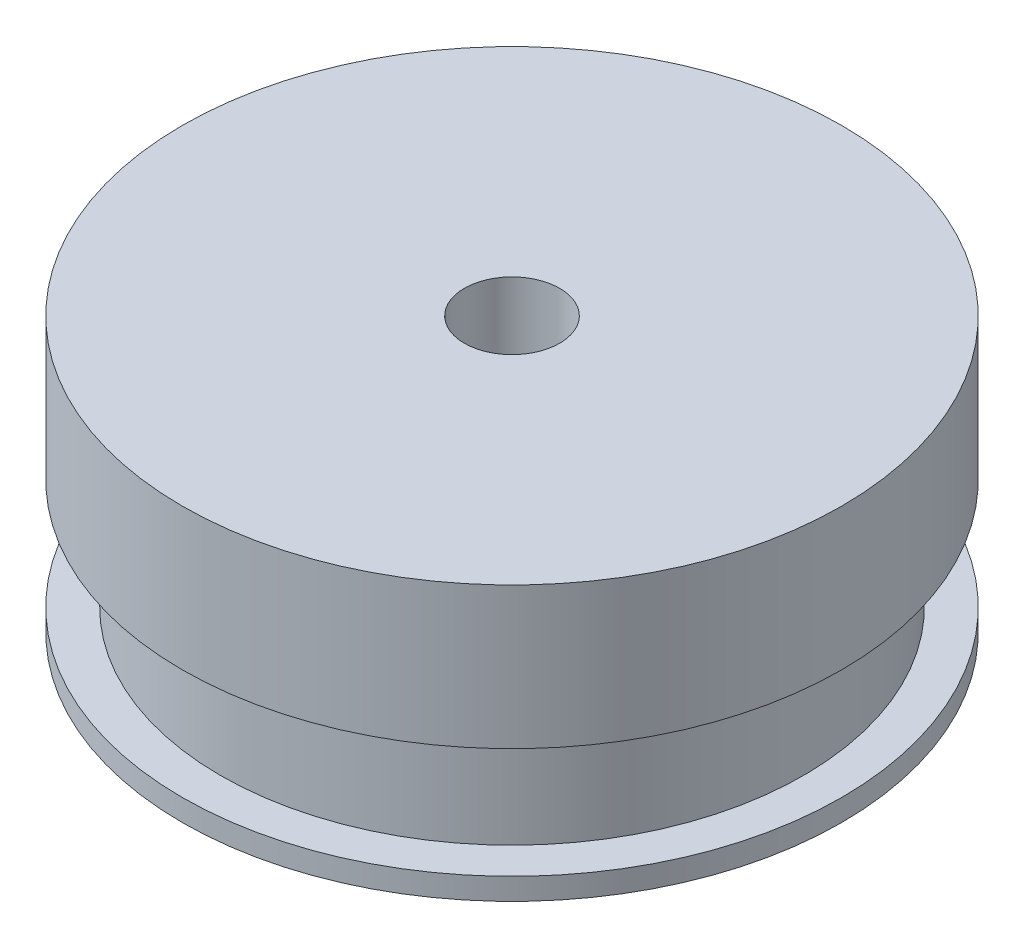
from build123d import *

# Parameters (mm, degrees)
SKETCH1_R           = 21.971
SKETCH1_R_2         = 3.175
BOSS_EXTRUDE1_DEPTH = 18.2626
SKETCH2_W           = 2.54
SKETCH2_H           = 7.366


with BuildPart() as part:
    # Sketch1 → Boss-Extrude1 (new body)
    with BuildSketch(Plane(origin=(0, 0, 0), x_dir=(1, 0, 0), z_dir=(0, 1, 0))):
        Circle(SKETCH1_R)
        Circle(SKETCH1_R_2, mode=Mode.SUBTRACT)
    extrude(amount=BOSS_EXTRUDE1_DEPTH)

    # Sketch2 → Cut-Revolve1 (revolve, cut)
    with BuildSketch(Plane(origin=(0, 0, 0), x_dir=(0, 0, -1), z_dir=(1, 0, 0))):
        with Locations((20.701, 5.1308)):
            Rectangle(SKETCH2_W, SKETCH2_H)
    revolve(axis=Axis((0, 18.2626, 0), (0, -1, 0)), mode=Mode.SUBTRACT)


solid = part.part
